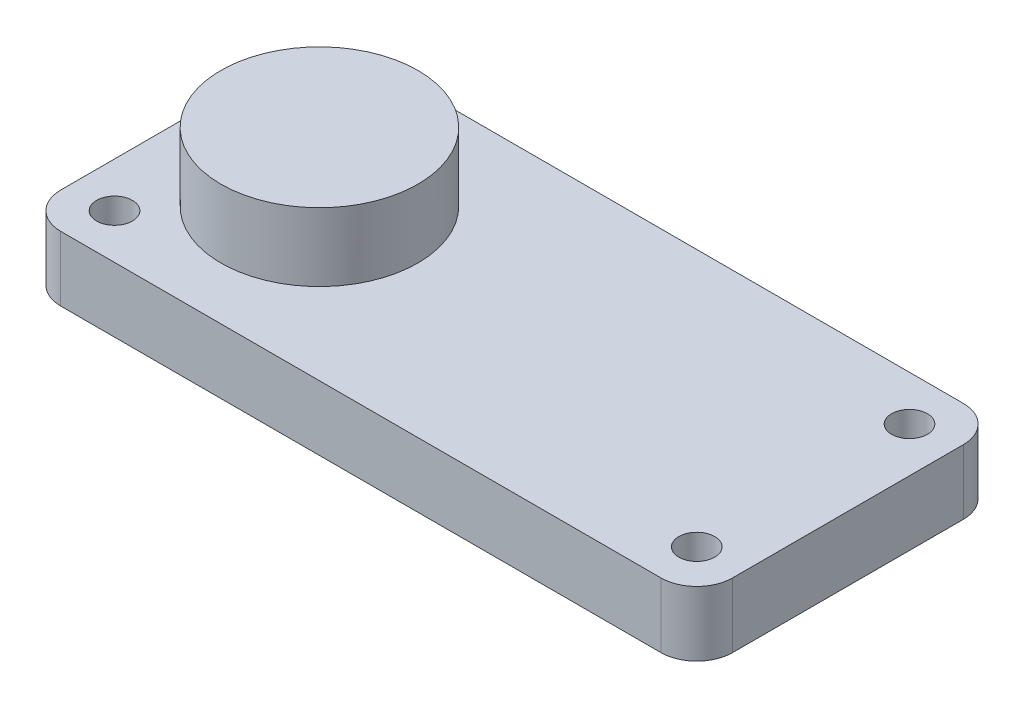
from build123d import *

# Parameters (mm, degrees)
SKETCH2_R           = 1.6
BOSS_EXTRUDE1_DEPTH = 5.78
SKETCH3_R           = 8.8
BOSS_EXTRUDE2_DEPTH = 6.1


with BuildPart() as part:
    # Sketch2 → Boss-Extrude1 (new body)
    with BuildSketch(Plane(origin=(0, 0, 0), x_dir=(1, 0, 0), z_dir=(0, 1, 0))):
        with BuildLine():
            Line((-26.8, -13.5), (26.8, -13.5))
            ThreePointArc((26.8, -13.5), (29.0627417, -12.5627417), (30, -10.3))
            Line((30, -10.3), (30, 10.3))
            ThreePointArc((30, 10.3), (29.0627417, 12.5627417), (26.8, 13.5))
            Line((26.8, 13.5), (-26.8, 13.5))
            ThreePointArc((-26.8, 13.5), (-29.0627417, 12.5627417), (-30, 10.3))
            Line((-30, 10.3), (-30, -10.3))
            ThreePointArc((-30, -10.3), (-29.0627417, -12.5627417), (-26.8, -13.5))
        make_face()
        with Locations((26, 9.5)):
            Circle(SKETCH2_R, mode=Mode.SUBTRACT)
        with Locations((-26, 9.5)):
            Circle(SKETCH2_R, mode=Mode.SUBTRACT)
        with Locations((-26, -9.5)):
            Circle(SKETCH2_R, mode=Mode.SUBTRACT)
        with Locations((26, -9.5)):
            Circle(SKETCH2_R, mode=Mode.SUBTRACT)
    extrude(amount=BOSS_EXTRUDE1_DEPTH)

    # Sketch3 → Boss-Extrude2 (add)
    with BuildSketch(Plane(origin=(0, 5.78, 0), x_dir=(1, 0, 0), z_dir=(0, 1, 0))):
        with Locations((-17.2, 0)):
            Circle(SKETCH3_R)
    extrude(amount=BOSS_EXTRUDE2_DEPTH)


solid = part.part
